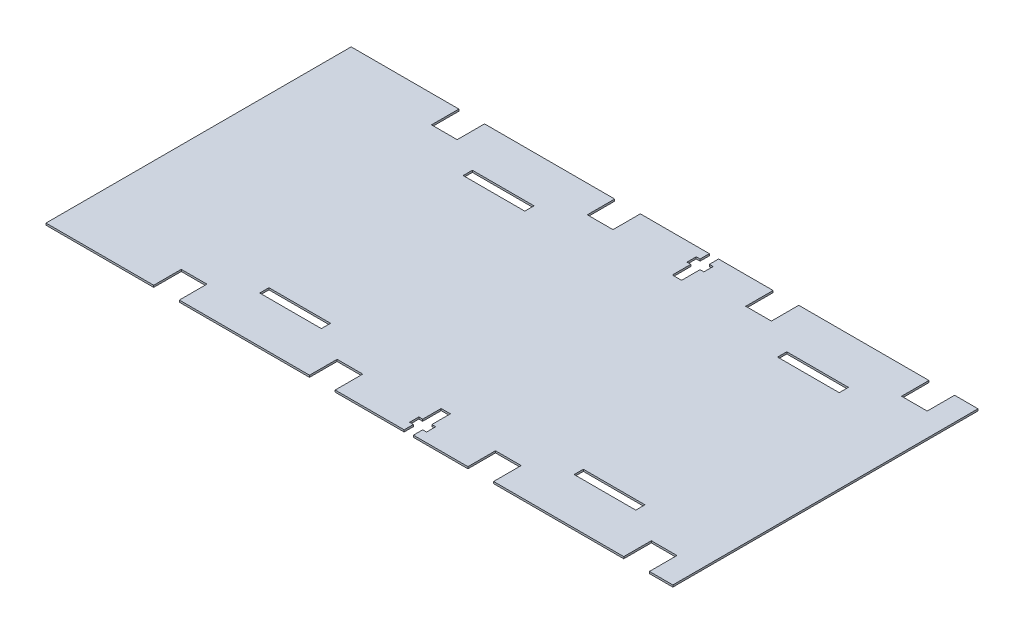
from build123d import *

# Parameters (mm, degrees)
SKETCH2_W           = 96.8013
SKETCH2_H           = 14.48
SKETCH2_H_2         = 14.4767
BOSS_EXTRUDE1_DEPTH = 3


with BuildPart() as part:
    # Sketch2 → Boss-Extrude1 (new body)
    with BuildSketch(Plane(origin=(0, 0, 0), x_dir=(1, 0, 0), z_dir=(0, 1, 0))):
        Polygon((455.3827, -196.3256), (455.3827, -239.5823), (492.153, -239.5823), (492.153, 239.5823), (455.3827, 239.5823), (455.3827, 196.6024), (415.0808, 196.6024), (415.0808, 239.5823), (210.7031, 239.5823), (210.7031, 196.6024), (170.3995, 196.6024), (170.3995, 239.5823), (84.7783, 239.5823), (84.7783, 225.0622), (90.8278, 225.0622), (90.8278, 210.5355), (84.7783, 210.5355), (84.7783, 181.4938), (70.2566, 181.4938), (70.2566, 210.5355), (64.2055, 210.5355), (64.2055, 225.0622), (70.2566, 225.0622), (70.2566, 239.5823), (-38.04, 239.5823), (-38.04, 196.6024), (-78.342, 196.6024), (-78.342, 239.5823), (-282.7213, 239.5823), (-282.7213, 196.6024), (-323.0233, 196.6024), (-323.0233, 239.5823), (-492.153, 239.5823), (-492.153, -239.5823), (-323.0233, -239.5823), (-323.0233, -196.3256), (-282.7213, -196.3256), (-282.7213, -239.5823), (-78.342, -239.5823), (-78.342, -196.3256), (-38.04, -196.3256), (-38.04, -239.5823), (70.2566, -239.5823), (70.2566, -225.0622), (64.2055, -225.0622), (64.2055, -210.5422), (70.2566, -210.5422), (70.2566, -181.5021), (84.7783, -181.5021), (84.7783, -210.5422), (90.8278, -210.5422), (90.8278, -225.0622), (84.7783, -225.0622), (84.7783, -239.5823), (170.3995, -239.5823), (170.3995, -196.3256), (210.7031, -196.3256), (210.7031, -239.5823), (415.0808, -239.5823), (415.0808, -196.3256), align=None)
        Polygon((-229.1949, -152.4721), (-229.1949, -166.9521), (-132.3936, -166.9521), (-132.3953, -152.4721), align=None, mode=Mode.SUBTRACT)
        Polygon((-229.1949, 166.9754), (-229.1949, 152.4987), (-132.3936, 152.4987), (-132.3953, 166.9754), align=None, mode=Mode.SUBTRACT)
        with Locations((312.89195, -159.7121)):
            Rectangle(SKETCH2_W, SKETCH2_H, mode=Mode.SUBTRACT)
        with Locations((312.89195, 159.73705)):
            Rectangle(SKETCH2_W, SKETCH2_H_2, mode=Mode.SUBTRACT)
    extrude(amount=BOSS_EXTRUDE1_DEPTH)


solid = part.part
